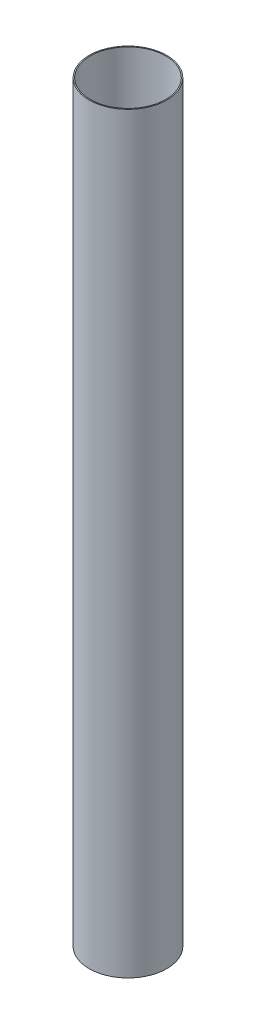
from build123d import *

# Parameters (mm, degrees)
SKETCH1_R           = 78.5876
SKETCH1_R_2         = 76.454
BOSS_EXTRUDE1_DEPTH = 1524


with BuildPart() as part:
    # Sketch1 → Boss-Extrude1 (new body)
    with BuildSketch(Plane(origin=(0, 0, 0), x_dir=(1, 0, 0), z_dir=(0, 1, 0))):
        Circle(SKETCH1_R)
        Circle(SKETCH1_R_2, mode=Mode.SUBTRACT)
    extrude(amount=BOSS_EXTRUDE1_DEPTH)


solid = part.part
